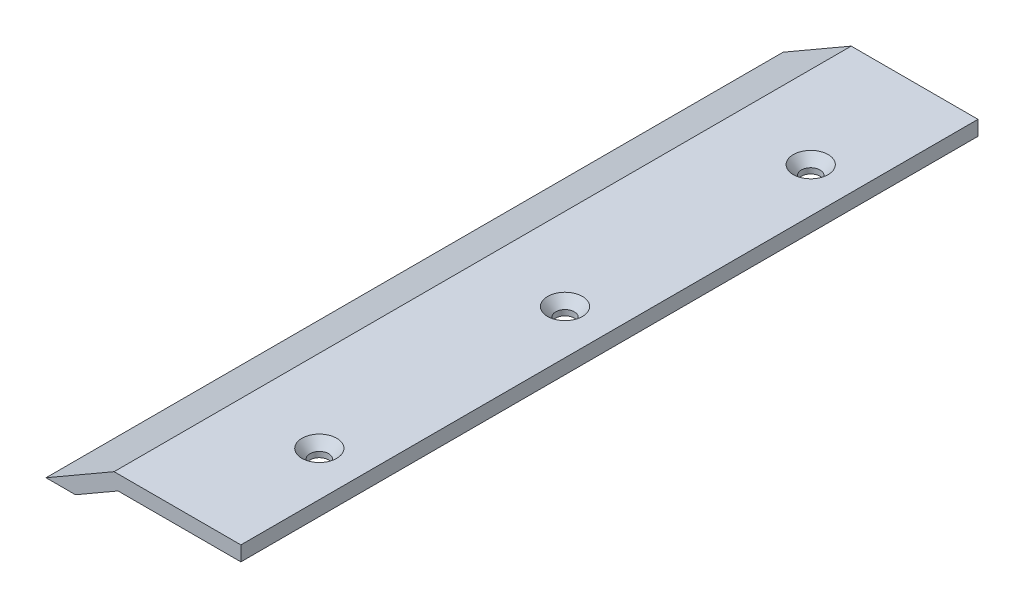
from build123d import *

# Parameters (mm, degrees)
SALIENTE_EXTRUIR1_DEPTH                              = 75
AVELLANADO_PARA_TORNILLO_CON_CABEZA_OVAL_D           = 3.7973
AVELLANADO_PARA_TORNILLO_CON_CABEZA_OVAL_DEPTH       = 20
AVELLANADO_PARA_TORNILLO_CON_CABEZA_OVAL_CSINK_D     = 7.0866
AVELLANADO_PARA_TORNILLO_CON_CABEZA_OVAL_CSINK_ANGLE = 82
AVELLANADO_PARA_TORNILLO_CON_CABEZA_OVAL_TIP         = 1.140824014


with BuildPart() as part:
    # Croquis1 → Saliente-Extruir1 (new, symmetric)
    with BuildSketch(Plane.XY):
        Polygon((25, 0), (25, 3), (-0.803847577, 3), (-14.660254038, -5), (-8.660254038, -5), (0, 0), align=None)
    extrude(amount=SALIENTE_EXTRUIR1_DEPTH, both=True)

    # Avellanado para tornillo con cabeza ovalada de #61
    with Locations(Plane(origin=(15.959745962, 3, -50), x_dir=(1, 0, 0), z_dir=(0, 1, 0))):
        with Locations((0, 0), (0, -50), (0, -100)):
            CounterSinkHole(AVELLANADO_PARA_TORNILLO_CON_CABEZA_OVAL_D / 2, AVELLANADO_PARA_TORNILLO_CON_CABEZA_OVAL_CSINK_D / 2, depth=AVELLANADO_PARA_TORNILLO_CON_CABEZA_OVAL_DEPTH, counter_sink_angle=AVELLANADO_PARA_TORNILLO_CON_CABEZA_OVAL_CSINK_ANGLE)
            with Locations((0, 0, -(AVELLANADO_PARA_TORNILLO_CON_CABEZA_OVAL_DEPTH + AVELLANADO_PARA_TORNILLO_CON_CABEZA_OVAL_TIP / 2))):  # 118° drill point
                Cone(0, AVELLANADO_PARA_TORNILLO_CON_CABEZA_OVAL_D / 2, AVELLANADO_PARA_TORNILLO_CON_CABEZA_OVAL_TIP, mode=Mode.SUBTRACT)


solid = part.part
